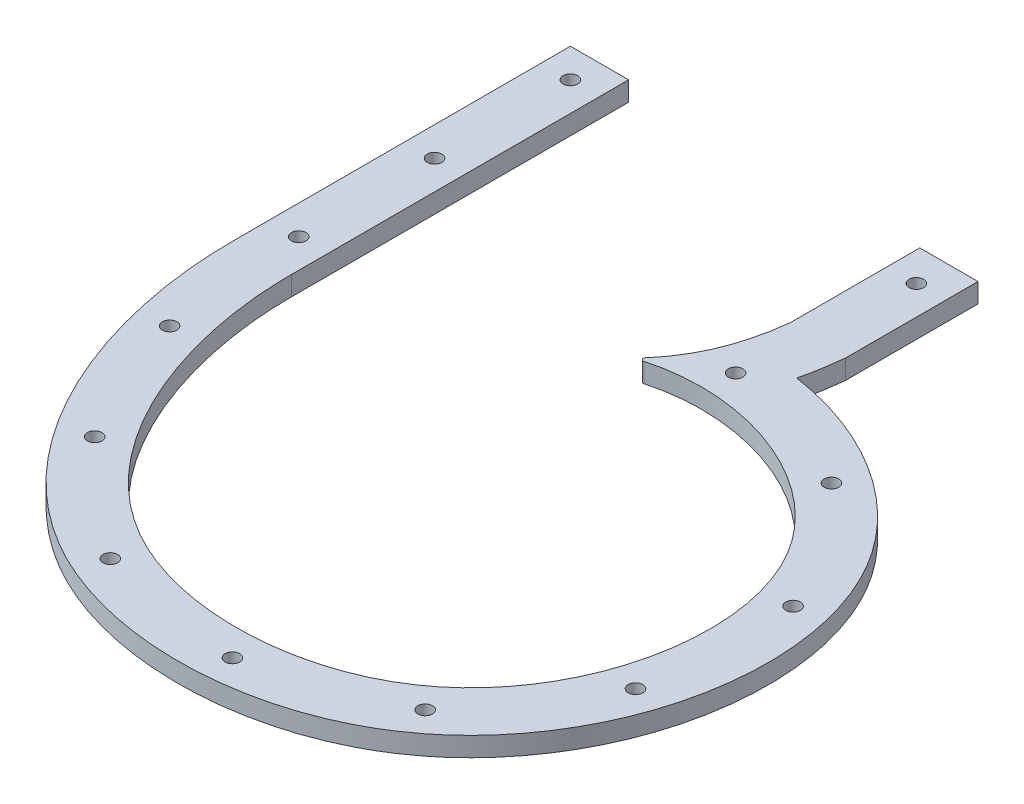
from build123d import *

# Parameters (mm, degrees)
BOSS_EXTRUDE1_DEPTH   = 6.35
FILLET1_R             = 2.54
FILLET2_R             = 0.79375
SKETCH4_R             = 2.38125
CUT_EXTRUDE3_DEPTH    = 6.35
CRVPATTERN1_OUTLINE_R = 2.38125
CRVPATTERN1_DEPTH     = 6.35


# Read off the part's stored shape, not the designer's step: CrvPattern1
with BuildPart() as part:
    # Sketch1 → Boss-Extrude1 (new body)
    with BuildSketch(Plane(origin=(0, 0, 0), x_dir=(1, 0, 0), z_dir=(0, 1, 0))):
        with BuildLine():
            Line((0, 136.334024978), (0, 94.083801247))
            add(Edge.make_bspline(
                [(0, 94.083801247), (-2.431386336, 71.693275709), (-15.75825593, 58.230430146)],
                knots=[0, 0, 0, 1, 1, 1], degree=2))
            add(Edge.make_bspline(
                [(-15.75825593, 58.230430146), (12.928997408, 67.764135595), (70.60122301, 46.247103047), (77.540383798, -26.213493844), (40.518788725, -85.775261158), (-67.055108572, -88.304279922), (-95.415707681, -10.214485927), (-95.25, 26.030170649)],
                knots=[0, 0, 0, 0, 0.227546357, 0.356849793, 0.49581236, 0.710996888, 1, 1, 1, 1], degree=3))
            Line((-95.25, 26.030170649), (-95.25, 136.334024978))
            Line((-95.25, 136.334024978), (-114.3, 136.334024978))
            Line((-114.3, 136.334024978), (-114.3, 26.072111228))
            add(Edge.make_bspline(
                [(16.715986391, 79.348568009), (21.633097871, 78.62719896), (31.371857261, 76.389721894), (45.249200497, 70.845276961), (58.14270202, 63.202354702), (69.694268499, 53.486594004), (77.831645881, 43.678743898), (83.1663553, 34.778326042), (87.500656656, 25.500338712), (91.157064432, 13.400044888), (92.998924079, -1.463666218), (92.533158628, -16.332160856), (89.911348046, -30.922868008), (85.224669703, -44.926534482), (78.5424766, -58.087321563), (69.892966554, -70.128088223), (59.334225085, -80.722518946), (46.808294676, -89.48437896), (33.165750854, -95.831204537), (18.8220758, -100.00043745), (4.083822861, -102.101602424), (-10.777441223, -102.219799961), (-25.504851136, -100.381408636), (-37.452741503, -97.197322494), (-46.66563909, -93.622653994), (-53.378233983, -90.404269128), (-59.778019163, -86.667831837), (-67.772964247, -81.11349497), (-76.794838317, -73.191996697), (-86.082507199, -62.480245978), (-96.526865188, -46.978935087), (-104.24741081, -30.151640125), (-109.53383183, -12.800694626), (-112.324631517, 0.306051107), (-113.698273493, 11.158780223), (-114.231429958, 19.740893087), (-114.308990648, 23.9549561), (-114.3, 26.072111228)],
                knots=[0.074418032, 0.074418032, 0.074418032, 0.074418032, 0.103339233, 0.132260434, 0.161181635, 0.190102836, 0.219024037, 0.233484638, 0.247945239, 0.27686644, 0.305787641, 0.334708842, 0.363630043, 0.392551244, 0.421472445, 0.450393647, 0.479314848, 0.508236049, 0.53715725, 0.566078451, 0.594999652, 0.623920853, 0.652842055, 0.681763256, 0.696223856, 0.710684457, 0.725145057, 0.739605658, 0.768526859, 0.79744806, 0.826369261, 0.884211664, 0.913132865, 0.942054066, 0.970975267, 0.985435868, 0.999896468, 0.999896468, 0.999896468, 0.999896468], degree=3))
            add(Edge.make_bspline(
                [(19.05, 93.052513121), (19.023571763, 92.809136693), (18.983692868, 92.443089224), (18.931467162, 91.958957236), (18.862360798, 91.337915751), (18.776292871, 90.610780885), (18.625902721, 89.42512839), (18.420122868, 87.959858448), (18.049990563, 85.627575808), (17.510143571, 82.743597147), (16.996105499, 80.478464636), (16.715986391, 79.348568009)],
                knots=[-0.022894974, -0.022894974, -0.022894974, -0.022894974, -0.006590549, 0.001561663, 0.009713876, 0.0260183, 0.042322725, 0.074931575, 0.107540425, 0.172758125, 0.237975825, 0.237975825, 0.237975825, 0.237975825], degree=3))
            Line((19.05, 93.052513121), (19.05, 136.334024978))
            Line((19.05, 136.334024978), (0, 136.334024978))
        make_face()
    extrude(amount=BOSS_EXTRUDE1_DEPTH)

    # Fillet1
    fillet1_edges = [part.edges().sort_by_distance(p)[0] for p in [
        (0, 3.175, -94.083801247),
        (-95.25, 3.175, -26.030170649),
    ]]
    fillet(fillet1_edges, radius=FILLET1_R)

    # Fillet2
    fillet2_edges = [part.edges().sort_by_distance(p)[0] for p in [
        (-15.75825593, 3.175, -58.230430146),
    ]]
    fillet(fillet2_edges, radius=FILLET2_R)

    # Sketch4 → Cut-Extrude3 (cut)
    with BuildSketch(Plane(origin=(0, 6.35, 0), x_dir=(1, 0, 0), z_dir=(0, 1, 0))):
        with Locations(Location((-104.775, 126.809024978, 0), (0, 0, 270))):
            Circle(SKETCH4_R)
    extrude(amount=-CUT_EXTRUDE3_DEPTH, mode=Mode.SUBTRACT)

    # CrvPattern1 outline → CrvPattern1 (cut)
    with BuildSketch(Plane(origin=(0, 0, 0), x_dir=(1, 0, 0), z_dir=(0, 1, 0))):
        with Locations((-104.775, 82.359024978)):
            Circle(CRVPATTERN1_OUTLINE_R)
        with Locations((-104.775, 37.909024978)):
            Circle(CRVPATTERN1_OUTLINE_R)
        with Locations((-100.597903535, -8.486356178)):
            Circle(CRVPATTERN1_OUTLINE_R)
        with Locations((-81.474554, -52.141471765)):
            Circle(CRVPATTERN1_OUTLINE_R)
        with Locations((-44.376132313, -84.112983027)):
            Circle(CRVPATTERN1_OUTLINE_R)
        with Locations((3.698987105, -92.246074321)):
            Circle(CRVPATTERN1_OUTLINE_R)
        with Locations((49.97064989, -75.450636534)):
            Circle(CRVPATTERN1_OUTLINE_R)
        with Locations((78.388040736, -35.058632959)):
            Circle(CRVPATTERN1_OUTLINE_R)
        with Locations((80.782414242, 14.106535639)):
            Circle(CRVPATTERN1_OUTLINE_R)
        with Locations((52.182738061, 55.247486043)):
            Circle(CRVPATTERN1_OUTLINE_R)
        with Locations((5.302146984, 70.7696737)):
            Circle(CRVPATTERN1_OUTLINE_R)
        with Locations((9.525, 125.703541591)):
            Circle(CRVPATTERN1_OUTLINE_R)
    extrude(amount=CRVPATTERN1_DEPTH, mode=Mode.SUBTRACT)


solid = part.part
